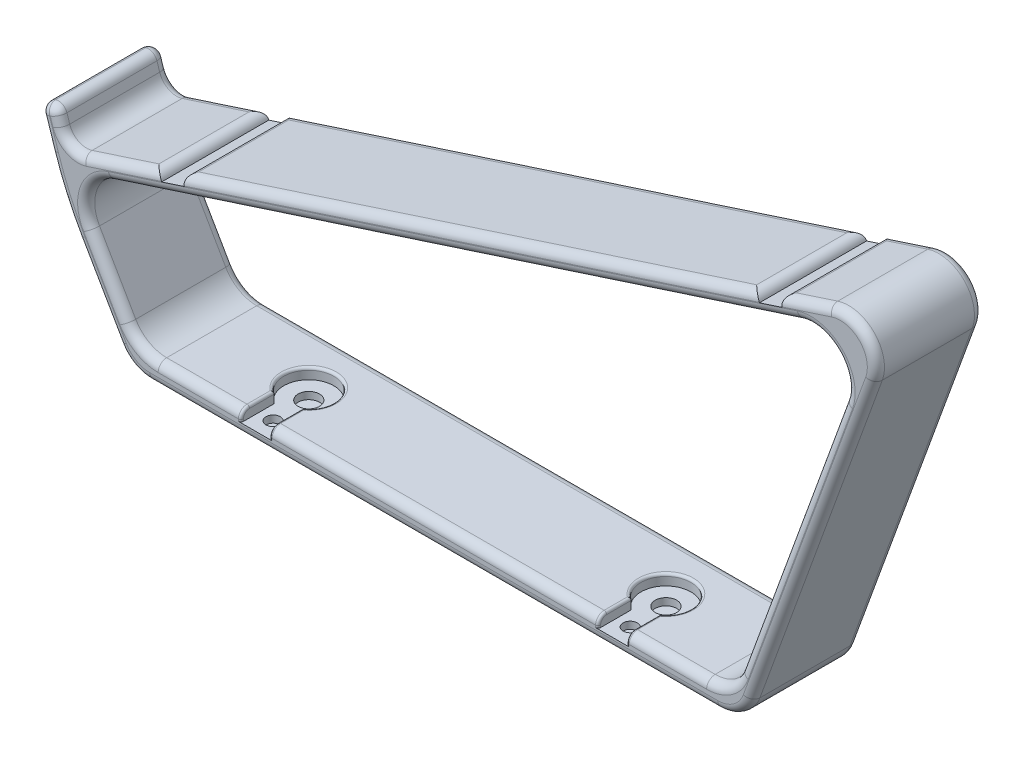
from build123d import *

# Parameters (mm, degrees)
BOSS_EXTRUDE1_DEPTH = 30
FILLET1_R           = 10
FILLET2_R           = 90
FILLET3_R           = 2.5
FILLET4_R           = 5
FILLET6_R           = 2.4
SKETCH17_W          = 20
SKETCH17_H          = 25
CUT_EXTRUDE4_DEPTH  = 1
SKETCH15_W          = 6.7
SKETCH15_H          = 30
CUT_EXTRUDE2_DEPTH  = 2.5
CUT_EXTRUDE3_START  = -30
CUT_EXTRUDE3_DEPTH  = 30.000005
SKETCH14_W          = 8
SKETCH14_H          = 2.4
CUT_EXTRUDE1_DEPTH  = 3
SKETCH18_R          = 3
SKETCH18_R_2        = 2
CUT_EXTRUDE5_DEPTH  = 2
FILLET5_R           = 0.7


with BuildPart() as part:
    # Sketch13 → Boss-Extrude1 (new body)
    with BuildSketch(Plane.XY):
        Polygon((-98.977787134, 0), (72.829483755, 0), (116.505911867, 120), (-116.505911867, 44.3), (-119.595707786, 53.810686683), (-124.351051127, 52.265788724), (-118.17145929, 33.244415358), align=None)
        Polygon((-115.865710961, 39.250742102), (108.301397672, 112.077304512), (69.692416298, 6), (-96.668386058, 6), align=None, mode=Mode.SUBTRACT)
    extrude(amount=BOSS_EXTRUDE1_DEPTH)

    # Fillet1
    fillet1_edges = [part.edges().sort_by_distance(p)[0] for p in [
        (116.505911867, 120, 15),
        (72.829483755, 0, 15),
        (-98.977787134, 0, 15),
        (-115.865710961, 39.250742102, 15),
        (-96.668386058, 6, 15),
        (69.692416298, 6, 15),
        (108.301397672, 112.077304512, 15),
    ]]
    fillet(fillet1_edges, radius=FILLET1_R)

    # Fillet2
    fillet2_edges = [part.edges().sort_by_distance(p)[0] for p in [
        (-118.17145929, 33.244415358, 15),
    ]]
    fillet(fillet2_edges, radius=FILLET2_R)

    # Fillet3
    fillet3_edges = [part.edges().sort_by_distance(p)[0] for p in [
        (-119.595707786, 53.810686683, 15),
        (-124.351051127, 52.265788724, 15),
    ]]
    fillet(fillet3_edges, radius=FILLET3_R - 0.0001)  # a hair under: the kernel refuses the full size

    # Fillet4
    fillet4_edges = [part.edges().sort_by_distance(p)[0] for p in [
        (-116.505911867, 44.3, 15),
    ]]
    fillet(fillet4_edges, radius=FILLET4_R)

    # Fillet6
    fillet6_edges = [part.edges().sort_by_distance(p)[0] for p in [
        (-118.437049765, 50.24422673, 0),
        (-118.437049765, 50.24422673, 30),
        (-115.565594185, 46.145297954, 0),
        (-115.565594185, 46.145297954, 30),
        (-7.65897272, 74.404537963, 0),
        (-7.65897272, 74.404537963, 30),
        (-104.623057163, 19.777894512, 0),
        (-104.623057163, 19.777894512, 30),
        (-13.688438035, 0, 0),
        (-13.688438035, 0, 30),
        (-7.371740484, 79.755096833, 0),
        (92.359072133, 53.657103079, 0),
        (-14.102271225, 6, 0),
        (86.688281307, 52.695755335, 0),
        (71.563172737, 1.808479557, 0),
        (-98.204284443, 1.339745962, 0),
        (92.359072133, 53.657103079, 30),
        (-7.371740484, 79.755096833, 30),
        (86.688281307, 52.695755335, 30),
        (-14.102271225, 6, 30),
        (71.563172737, 1.808479557, 30),
        (-98.204284443, 1.339745962, 30),
        (-110.36645668, 37.139652094, 0),
        (-110.36645668, 37.139652094, 30),
        (-95.894883366, 7.339745962, 0),
        (-95.894883366, 7.339745962, 30),
        (68.42610528, 7.808479557, 0),
        (68.42610528, 7.808479557, 30),
        (99.085903878, 103.178355791, 0),
        (99.085903878, 103.178355791, 30),
        (107.290418073, 111.101051279, 0),
        (107.290418073, 111.101051279, 30),
        (-107.652706274, 15.0254007, 0),
        (-107.652706274, 15.0254007, 30),
        (-117.718398708, 33.446120251, 0),
        (-117.718398708, 33.446120251, 30),
        (-122.336700459, 46.065425148, 0),
        (-123.428439056, 51.795648689, 0),
        (-120.06584782, 52.888074612, 0),
        (-122.336700459, 46.065425148, 30),
        (-123.428439056, 51.795648689, 30),
        (-120.06584782, 52.888074612, 30),
    ]]
    fillet(fillet6_edges, radius=FILLET6_R)

    # Sketch17 → Cut-Extrude4 (cut)
    with BuildSketch(Plane.XZ):
        with Locations((-79.454284443, 15)):
            Rectangle(SKETCH17_W, SKETCH17_H)
        with Locations((52.077408373, 15)):
            Rectangle(SKETCH17_W, SKETCH17_H)
    extrude(amount=-CUT_EXTRUDE4_DEPTH, mode=Mode.SUBTRACT)

    # Sketch15 → Cut-Extrude2 (cut)
    with BuildSketch(Plane(origin=(-24.140665455, 74.307271912, 0), x_dir=(0.9510686683034012, 0.3089795918367347, 0), z_dir=(-0.3089795918367347, 0.9510686683034012, 0))):
        with Locations((-66.617326531, -15)):
            Rectangle(SKETCH15_W, SKETCH15_H)
        with Locations((109.382673469, -15)):
            Rectangle(SKETCH15_W, SKETCH15_H)
    extrude(amount=-CUT_EXTRUDE2_DEPTH, mode=Mode.SUBTRACT)

    # Sketch16 → Cut-Extrude3 (cut)
    with BuildSketch(Plane.XY.offset(30).offset(CUT_EXTRUDE3_START)):
        with BuildLine():
            Line((74.326016428, 106.296755102), (76.703688099, 107.069204082))
            Line((76.703688099, 107.069204082), (77.476137078, 104.691532411))
            ThreePointArc((77.476137078, 104.691532411), (76.233529258, 106.146555105), (74.326016428, 106.296755102))
        make_face()
        with BuildLine():
            Line((83.075848176, 109.139367347), (83.848297156, 106.761695676))
            ThreePointArc((83.848297156, 106.761695676), (83.998497153, 108.669208506), (85.453519847, 109.911816327))
            Line((85.453519847, 109.911816327), (83.075848176, 109.139367347))
        make_face()
        with BuildLine():
            Line((-90.684397523, 52.688795918), (-89.911948543, 50.311124248))
            ThreePointArc((-89.911948543, 50.311124248), (-91.154556364, 51.766146941), (-93.062069193, 51.916346939))
            Line((-93.062069193, 51.916346939), (-90.684397523, 52.688795918))
        make_face()
        with BuildLine():
            Line((-81.934565774, 55.531408163), (-84.312237445, 54.758959184))
            Line((-84.312237445, 54.758959184), (-83.539788466, 52.381287513))
            ThreePointArc((-83.539788466, 52.381287513), (-83.389588468, 54.288800343), (-81.934565774, 55.531408163))
        make_face()
    extrude(amount=CUT_EXTRUDE3_DEPTH, mode=Mode.SUBTRACT)

    # Sketch14 → Cut-Extrude1 (cut)
    with BuildSketch(Plane(origin=(0, 6, 0), x_dir=(1, 0, 0), z_dir=(0, 1, 0))):
        with Locations((36.3, -28.8)):
            Rectangle(SKETCH14_W, SKETCH14_H)
        with BuildLine():
            Line((32.3, -20.744562647), (32.3, -27.6))
            Line((32.3, -27.6), (40.3, -27.6))
            Line((40.3, -27.6), (40.3, -20.744562647))
            ThreePointArc((40.3, -20.744562647), (36.3, -8), (32.3, -20.744562647))
        make_face()
        with Locations((-63.7, -28.8)):
            Rectangle(SKETCH14_W, SKETCH14_H)
        with BuildLine():
            ThreePointArc((-59.7, -20.744562647), (-63.7, -8), (-67.7, -20.744562647))
            Line((-67.7, -20.744562647), (-67.7, -27.6))
            Line((-67.7, -27.6), (-59.7, -27.6))
            Line((-59.7, -27.6), (-59.7, -20.744562647))
        make_face()
    extrude(amount=-CUT_EXTRUDE1_DEPTH, mode=Mode.SUBTRACT)

    # Sketch18 → Cut-Extrude5 (cut)
    with BuildSketch(Plane(origin=(0, 3, 0), x_dir=(1, 0, 0), z_dir=(0, 1, 0))):
        with Locations(Location((-63.7, -15, 0), (0, 0, 180))):
            Circle(SKETCH18_R)
        with Locations(Location((-63.7, -25, 0), (0, 0, 180))):
            Circle(SKETCH18_R_2)
        with Locations((36.3, -25)):
            Circle(SKETCH18_R_2)
        with Locations((36.3, -15)):
            Circle(SKETCH18_R)
    extrude(amount=-CUT_EXTRUDE5_DEPTH, mode=Mode.SUBTRACT)

    # Fillet5
    fillet5_edges = [part.edges().sort_by_distance(p)[0] for p in [
        (-59.7, 5.297056275, 29.297056275),
        (-67.7, 5.297056275, 29.297056275),
        (32.3, 5.297056275, 29.297056275),
        (40.3, 5.297056275, 29.297056275),
        (32.3, 6, 24.172281323),
        (40.3, 6, 24.172281323),
        (40.3, 3.3, 30),
        (32.3, 3.3, 30),
        (36.3, 6, 8),
        (-67.7, 6, 24.172281323),
        (-63.7, 6, 8),
        (-59.7, 3.3, 30),
        (-67.7, 3.3, 30),
        (-59.7, 6, 24.172281323),
    ]]
    fillet(fillet5_edges, radius=FILLET5_R)


solid = part.part
